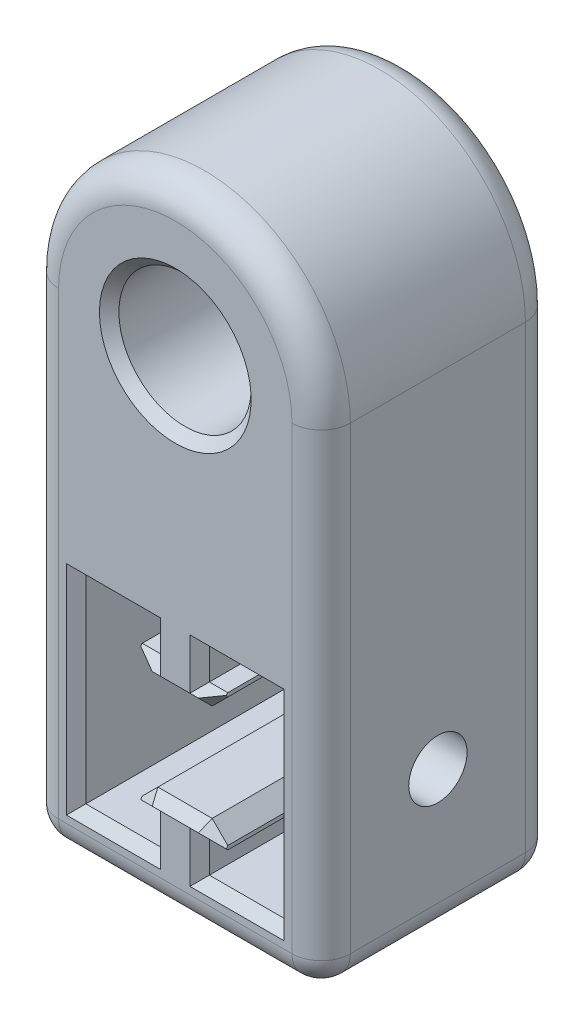
from build123d import *

# Parameters (mm, degrees)
BOSS_EXTRUDE1_DEPTH = 24
SKETCH4_R           = 6.8
BOSS_EXTRUDE2_DEPTH = 24
SKETCH3_R           = 3
CUT_EXTRUDE1_DEPTH  = 64.293680569
FILLET1_R           = 3
SKETCH5_R           = 6.8
SKETCH5_R_2         = 5.5
BOSS_EXTRUDE3_DEPTH = 5
CHAMFER1_SIZE       = 1


with BuildPart() as part:
    # Sketch1 → Boss-Extrude1 (new body)
    with BuildSketch(Plane.XY):
        Polygon((0, 15), (15, 15), (15, -14.949649214), (-15, -14.949649214), (-15, 15), align=None)
        Polygon((-10.2, 10.2), (-2.5, 10.2), (-2.5, 7), (-4.4, 7), (-4.4, 6.61), (-2.79, 5), (2.79, 5), (4.4, 6.61), (4.4, 7), (2.5, 7), (2.5, 10.2), (10.2, 10.2), (10.2, 3.1), (10.2, -3.1), (10.2, -10.2), (2.5, -10.2), (2.5, -7), (4.4, -7), (4.4, -6.61), (2.79, -5), (-2.79, -5), (-4.4, -6.61), (-4.4, -7), (-2.5, -7), (-2.5, -10.2), (-10.2, -10.2), (-10.2, -3.1), (-10.2, 3.1), align=None, mode=Mode.SUBTRACT)
    extrude(amount=BOSS_EXTRUDE1_DEPTH)

    # Sketch4 → Boss-Extrude2 (add)
    with BuildSketch(Plane(origin=(0, 0, 0), x_dir=(-1, 0, 0), z_dir=(0, 0, -1))):
        with BuildLine():
            ThreePointArc((-15, 35.3), (0, 50.3), (15, 35.3))
            Line((15, 35.3), (15, 15))
            Line((15, 15), (-15, 15))
            Line((-15, 15), (-15, 35.3))
        make_face()
        with Locations((0, 35.3)):
            Circle(SKETCH4_R, mode=Mode.SUBTRACT)
    extrude(amount=-BOSS_EXTRUDE2_DEPTH)

    # Sketch3 → Cut-Extrude1 (cut, through all)
    with BuildSketch(Plane.ZY.offset(15)):
        with Locations((12, 0)):
            Circle(SKETCH3_R)
    extrude(amount=-CUT_EXTRUDE1_DEPTH, mode=Mode.SUBTRACT)

    # Fillet1
    fillet1_edges = [part.edges().sort_by_distance(p)[0] for p in [
        (0, -14.949649214, 24),
        (15, 10.175175393, 24),
        (15, 10.175175393, 0),
        (0, -14.949649214, 0),
        (-15, 10.175175393, 0),
        (-15, 10.175175393, 24),
        (15, -14.949649214, 12),
        (-15, -14.949649214, 12),
        (0, 50.3, 24),
        (0, 50.3, 0),
    ]]
    fillet(fillet1_edges, radius=FILLET1_R)

    # Sketch5 → Boss-Extrude3 (add)
    with BuildSketch(Plane(origin=(0, 0, 0), x_dir=(-1, 0, 0), z_dir=(0, 0, -1))):
        with Locations((0, 35.3)):
            Circle(SKETCH5_R)
        with Locations((0, 35.3)):
            Circle(SKETCH5_R_2, mode=Mode.SUBTRACT)
    extrude(amount=-BOSS_EXTRUDE3_DEPTH)

    # Chamfer1
    # the kernel refuses this chamfer: 1 mm, written as the material it takes off along each edge
    with BuildSketch(Plane(origin=(-6.21845448, 8.42845448, 0), x_dir=(-0.019442520806014184, -0.01944252080601427, 0.9996219169112968), z_dir=(0.7071067811865491, -0.707106781186546, 0)), Plane(origin=(0.97154552, 3.18154552, 0), x_dir=(0.01944252080601413, -0.019442520806014215, 0.9996219169112968), z_dir=(0.7071067811865491, 0.707106781186546, 0)), Plane(origin=(6.21845448, -8.42845448, 0), x_dir=(0.01944252080601417, 0.019442520806014284, 0.9996219169112968), z_dir=(-0.7071067811865497, 0.7071067811865456, 0)), Plane(origin=(-0.97154552, -3.18154552, 0), x_dir=(-0.019442520806014007, 0.01944252080601412, 0.9996219169112968), z_dir=(-0.7071067811865497, -0.7071067811865456, 0)), Plane(origin=(-0.97154552, -3.18154552, 24), x_dir=(0.7068394360706715, -0.7068394360706756, 0.027495876610585623), z_dir=(-0.7071067811865497, -0.7071067811865456, 0)), Plane(origin=(6.21845448, -8.42845448, 24), x_dir=(-0.7068394360706715, -0.7068394360706756, 0.027495876610585647), z_dir=(-0.7071067811865497, 0.7071067811865456, 0)), Plane(origin=(0.97154552, 3.18154552, 24), x_dir=(-0.7068394360706718, 0.7068394360706751, 0.027495876610585623), z_dir=(0.7071067811865491, 0.707106781186546, 0)), Plane(origin=(-6.21845448, 8.42845448, 24), x_dir=(0.706839436070672, 0.706839436070675, 0.02749587661058563), z_dir=(0.7071067811865491, -0.707106781186546, 0))) as chamfer1_piece_1:
        Polygon((CHAMFER1_SIZE * 0.999621916911, -CHAMFER1_SIZE * 0.0274958766106), (-CHAMFER1_SIZE * 0.0274958766106, -CHAMFER1_SIZE * 0.999621916911), (0, 0), align=None)
    extrude(amount=7.420249811, mode=Mode.SUBTRACT)
    with BuildSketch(Plane(origin=(-5.361682988, 5, 0), x_dir=(0, -0.027495876610586494, 0.9996219169112968), z_dir=(1, 0, 0)), Plane(origin=(5.361682988, -5, 0), x_dir=(0, 0.027495876610586494, 0.9996219169112968), z_dir=(-1, 0, 0)), Plane(origin=(5.361682988, -5, 24), x_dir=(0, -0.9996219169112968, 0.027495876610585623), z_dir=(-1, 0, 0)), Plane(origin=(-5.361682988, 5, 24), x_dir=(0, 0.9996219169112968, 0.027495876610585623), z_dir=(1, 0, 0))) as chamfer1_piece_2:
        Polygon((CHAMFER1_SIZE * 0.999621916911, -CHAMFER1_SIZE * 0.0274958766106), (-CHAMFER1_SIZE * 0.0274958766106, -CHAMFER1_SIZE * 0.999621916911), (0, 0), align=None)
    extrude(amount=10.723365976, mode=Mode.SUBTRACT)
    with BuildSketch(Plane(origin=(6.971682988, 7, 0), x_dir=(0, 0.027495876610586494, 0.9996219169112968), z_dir=(-1, 0, 0)), Plane(origin=(2.5, -7, 0), x_dir=(0, -0.027495876610586494, 0.9996219169112968), z_dir=(1, 0, 0)), Plane(origin=(-6.971682988, -7, 0), x_dir=(0, -0.027495876610586494, 0.9996219169112968), z_dir=(1, 0, 0)), Plane(origin=(-2.5, 7, 0), x_dir=(0, 0.027495876610586494, 0.9996219169112968), z_dir=(-1, 0, 0)), Plane(origin=(-6.971682988, -7, 24), x_dir=(1.4018567596735031e-15, 0.9996219169112968, 0.027495876610585623), z_dir=(1, 0, 0)), Plane(origin=(2.5, -7, 24), x_dir=(-1.4018567596735031e-15, 0.9996219169112968, 0.027495876610585623), z_dir=(1, 0, 0)), Plane(origin=(6.971682988, 7, 24), x_dir=(0, -0.9996219169112968, 0.027495876610585623), z_dir=(-1, 0, 0)), Plane(origin=(-2.5, 7, 24), x_dir=(0, -0.9996219169112968, 0.027495876610585623), z_dir=(-1, 0, 0))) as chamfer1_piece_3:
        Polygon((CHAMFER1_SIZE * 0.999621916911, -CHAMFER1_SIZE * 0.0274958766106), (-CHAMFER1_SIZE * 0.0274958766106, -CHAMFER1_SIZE * 0.999621916911), (0, 0), align=None)
    extrude(amount=4.471682988, mode=Mode.SUBTRACT)
    with BuildSketch(Plane(origin=(2.5, 7, 0), x_dir=(0.027495876610586494, 0, 0.9996219169112968), z_dir=(0, 1, 0)), Plane(origin=(2.5, -10.2, 0), x_dir=(0.027495876610586494, 0, 0.9996219169112968), z_dir=(0, 1, 0)), Plane(origin=(-2.5, -7, 0), x_dir=(-0.027495876610586494, 0, 0.9996219169112968), z_dir=(0, -1, 0)), Plane(origin=(-2.5, 10.2, 0), x_dir=(-0.027495876610586494, 0, 0.9996219169112968), z_dir=(0, -1, 0)), Plane(origin=(-2.5, 10.2, 24), x_dir=(0.9996219169112968, 3.56524299869048e-14, 0.02749587661058563), z_dir=(0, -1, 0)), Plane(origin=(-2.5, -7, 24), x_dir=(0.9996219169112968, -2.6357827616777824e-15, 0.02749587661058563), z_dir=(0, -1, 0)), Plane(origin=(2.5, -10.2, 24), x_dir=(-0.9996219169112968, -2.6357827616777824e-15, 0.02749587661058563), z_dir=(0, 1, 0)), Plane(origin=(2.5, 7, 24), x_dir=(-0.9996219169112968, 2.3583319446590688e-15, 0.02749587661058563), z_dir=(0, 1, 0))) as chamfer1_piece_4:
        Polygon((CHAMFER1_SIZE * 0.999621916911, -CHAMFER1_SIZE * 0.0274958766106), (-CHAMFER1_SIZE * 0.0274958766106, -CHAMFER1_SIZE * 0.999621916911), (0, 0), align=None)
    extrude(amount=3.2, mode=Mode.SUBTRACT)
    with BuildSketch(Plane(origin=(2.5, 10.2, 0), x_dir=(0, -0.02749587661058563, 0.9996219169112968), z_dir=(1, 0, 0)), Plane(origin=(10.2, -10.2, 0), x_dir=(0, 0.02749587661058563, 0.9996219169112968), z_dir=(-1, 0, 0)), Plane(origin=(-2.5, -10.2, 0), x_dir=(0, 0.02749587661058563, 0.9996219169112968), z_dir=(-1, 0, 0)), Plane(origin=(-10.2, 10.2, 0), x_dir=(0, -0.02749587661058563, 0.9996219169112968), z_dir=(1, 0, 0)), Plane(origin=(-10.2, 10.2, 24), x_dir=(0, 0.9996219169112968, 0.027495876610585647), z_dir=(1, 0, 0)), Plane(origin=(-2.5, -10.2, 24), x_dir=(0, -0.9996219169112968, 0.027495876610585647), z_dir=(-1, 0, 0)), Plane(origin=(10.2, -10.2, 24), x_dir=(0, -0.9996219169112968, 0.027495876610585647), z_dir=(-1, 0, 0)), Plane(origin=(2.5, 10.2, 24), x_dir=(0, 0.9996219169112968, 0.027495876610585647), z_dir=(1, 0, 0))) as chamfer1_piece_5:
        Polygon((CHAMFER1_SIZE * 0.999621916911, -CHAMFER1_SIZE * 0.0274958766106), (-CHAMFER1_SIZE * 0.0274958766106, -CHAMFER1_SIZE * 0.999621916911), (0, 0), align=None)
    extrude(amount=7.7, mode=Mode.SUBTRACT)
    with BuildSketch(Plane(origin=(10.2, 10.2, 0), x_dir=(-0.02749587661058908, 0, 0.9996219169112968), z_dir=(0, -1, 0)), Plane(origin=(-10.2, -10.2, 0), x_dir=(0.027495876610587354, 0, 0.9996219169112968), z_dir=(0, 1, 0))) as chamfer1_piece_6:
        Polygon((CHAMFER1_SIZE * 0.999621916911, -CHAMFER1_SIZE * 0.0274958766106), (-CHAMFER1_SIZE * 0.0274958766106, -CHAMFER1_SIZE * 0.999621916911), (0, 0), align=None)
    extrude(amount=20.4, mode=Mode.SUBTRACT)
    with BuildSketch(Plane(origin=(-10.2, 10.2, 24), x_dir=(-0.9996219169112968, 0, 0.027495876610585647), z_dir=(0, -1, 0)), Plane(origin=(10.2, -10.2, 24), x_dir=(0.9996219169112968, 0, 0.027495876610585647), z_dir=(0, 1, 0))) as chamfer1_piece_7:
        Polygon((CHAMFER1_SIZE * 0.999621916911, CHAMFER1_SIZE * 0.0274958766106), (-CHAMFER1_SIZE * 0.0274958766106, CHAMFER1_SIZE * 0.999621916911), (0, 0), align=None)
    extrude(amount=20.4, mode=Mode.SUBTRACT)
    with BuildSketch(Plane(origin=(0, 35.3, 24), x_dir=(-1, 0, 0), z_dir=(0, -1, 0))) as chamfer1_piece_8:
        Polygon((6.8 + CHAMFER1_SIZE, 0), (6.8, CHAMFER1_SIZE), (6.8, 0), align=None)
    revolve(axis=Axis((0, 35.3, 24), (0, 0, -1)), mode=Mode.SUBTRACT)
    with BuildSketch(Plane(origin=(0, 35.3, 0), x_dir=(-1, 0, 0), z_dir=(0, -1, 0))) as chamfer1_piece_9:
        Polygon((5.5 + CHAMFER1_SIZE, 0), (5.5, -CHAMFER1_SIZE), (5.5, 0), align=None)
    revolve(axis=Axis((0, 35.3, 0), (0, 0, -1)), mode=Mode.SUBTRACT)
    with BuildSketch(Plane(origin=(2.5, 4.428317012, 0), x_dir=(0.027495876610586494, 0, 0.9996219169112968), z_dir=(0, 1, 0))) as chamfer1_piece_10a_section:
        Polygon((CHAMFER1_SIZE * 0.999621916911, -CHAMFER1_SIZE * 0.0274958766106), (-CHAMFER1_SIZE * 0.0274958766106, -CHAMFER1_SIZE * 0.999621916911), (0, 0), align=None)
    chamfer1_piece_10a = extrude(amount=5.771682988, mode=Mode.PRIVATE)
    chamfer1_piece_10a = split(chamfer1_piece_10a, bisect_by=Plane(origin=(2.170206373, 7, 0.329793627), z_dir=(0, -1, 0)), keep=Keep.TOP, mode=Mode.PRIVATE)
    with BuildSketch(Plane(origin=(6.971682988, 7, 0), x_dir=(0, 0.027495876610586494, 0.9996219169112968), z_dir=(-1, 0, 0))) as chamfer1_piece_10b_section:
        Polygon((CHAMFER1_SIZE * 0.999621916911, -CHAMFER1_SIZE * 0.0274958766106), (-CHAMFER1_SIZE * 0.0274958766106, -CHAMFER1_SIZE * 0.999621916911), (0, 0), align=None)
    chamfer1_piece_10b = extrude(amount=7.043365976, mode=Mode.PRIVATE)
    chamfer1_piece_10b = split(chamfer1_piece_10b, bisect_by=Plane(origin=(2.5, 6.670206373, 0.329793627), z_dir=(-1, 0, 0)), keep=Keep.TOP, mode=Mode.PRIVATE)
    chamfer1_piece_10 = chamfer1_piece_10a & chamfer1_piece_10b
    add(chamfer1_piece_10, mode=Mode.SUBTRACT)
    with BuildSketch(Plane(origin=(-0.071682988, 10.2, 0), x_dir=(0, -0.02749587661058563, 0.9996219169112968), z_dir=(1, 0, 0))) as chamfer1_piece_11a_section:
        Polygon((CHAMFER1_SIZE * 0.999621916911, -CHAMFER1_SIZE * 0.0274958766106), (-CHAMFER1_SIZE * 0.0274958766106, -CHAMFER1_SIZE * 0.999621916911), (0, 0), align=None)
    chamfer1_piece_11a = extrude(amount=10.271682988, mode=Mode.PRIVATE)
    chamfer1_piece_11a = split(chamfer1_piece_11a, bisect_by=Plane(origin=(2.5, 10.529793627, 0.329793627), z_dir=(-1, 0, 0)), keep=Keep.TOP, mode=Mode.PRIVATE)
    with BuildSketch(Plane(origin=(2.5, 7, 0), x_dir=(0.027495876610586494, 0, 0.9996219169112968), z_dir=(0, 1, 0))) as chamfer1_piece_11b_section:
        Polygon((CHAMFER1_SIZE * 0.999621916911, -CHAMFER1_SIZE * 0.0274958766106), (-CHAMFER1_SIZE * 0.0274958766106, -CHAMFER1_SIZE * 0.999621916911), (0, 0), align=None)
    chamfer1_piece_11b = extrude(amount=5.771682988, mode=Mode.PRIVATE)
    chamfer1_piece_11b = split(chamfer1_piece_11b, bisect_by=Plane(origin=(2.170206373, 10.2, 0.329793627), z_dir=(0, 1, 0)), keep=Keep.TOP, mode=Mode.PRIVATE)
    chamfer1_piece_11 = chamfer1_piece_11a & chamfer1_piece_11b
    add(chamfer1_piece_11, mode=Mode.SUBTRACT)
    with BuildSketch(Plane(origin=(10.2, 12.771682988, 0), x_dir=(-0.02749587661058563, 0, 0.9996219169112968), z_dir=(0, -1, 0))) as chamfer1_piece_12a_section:
        Polygon((CHAMFER1_SIZE * 0.999621916911, -CHAMFER1_SIZE * 0.0274958766106), (-CHAMFER1_SIZE * 0.0274958766106, -CHAMFER1_SIZE * 0.999621916911), (0, 0), align=None)
    chamfer1_piece_12a = extrude(amount=22.971682988, mode=Mode.PRIVATE)
    chamfer1_piece_12a = split(chamfer1_piece_12a, bisect_by=Plane(origin=(10.529793627, 10.2, 0.329793627), z_dir=(0, 1, 0)), keep=Keep.TOP, mode=Mode.PRIVATE)
    with BuildSketch(Plane(origin=(2.5, 10.2, 0), x_dir=(0, -0.02749587661058563, 0.9996219169112968), z_dir=(1, 0, 0))) as chamfer1_piece_12b_section:
        Polygon((CHAMFER1_SIZE * 0.999621916911, -CHAMFER1_SIZE * 0.0274958766106), (-CHAMFER1_SIZE * 0.0274958766106, -CHAMFER1_SIZE * 0.999621916911), (0, 0), align=None)
    chamfer1_piece_12b = extrude(amount=10.271682988, mode=Mode.PRIVATE)
    chamfer1_piece_12b = split(chamfer1_piece_12b, bisect_by=Plane(origin=(10.2, 10.529793627, 0.329793627), z_dir=(1, 0, 0)), keep=Keep.TOP, mode=Mode.PRIVATE)
    chamfer1_piece_12 = chamfer1_piece_12a & chamfer1_piece_12b
    add(chamfer1_piece_12, mode=Mode.SUBTRACT)
    with BuildSketch(Plane(origin=(12.771682988, -10.2, 0), x_dir=(0, 0.02749587661058563, 0.9996219169112968), z_dir=(-1, 0, 0))) as chamfer1_piece_13a_section:
        Polygon((CHAMFER1_SIZE * 0.999621916911, -CHAMFER1_SIZE * 0.0274958766106), (-CHAMFER1_SIZE * 0.0274958766106, -CHAMFER1_SIZE * 0.999621916911), (0, 0), align=None)
    chamfer1_piece_13a = extrude(amount=10.271682988, mode=Mode.PRIVATE)
    chamfer1_piece_13a = split(chamfer1_piece_13a, bisect_by=Plane(origin=(10.2, -10.529793627, 0.329793627), z_dir=(1, 0, 0)), keep=Keep.TOP, mode=Mode.PRIVATE)
    with BuildSketch(Plane(origin=(10.2, 10.2, 0), x_dir=(-0.02749587661058908, 0, 0.9996219169112968), z_dir=(0, -1, 0))) as chamfer1_piece_13b_section:
        Polygon((CHAMFER1_SIZE * 0.999621916911, -CHAMFER1_SIZE * 0.0274958766106), (-CHAMFER1_SIZE * 0.0274958766106, -CHAMFER1_SIZE * 0.999621916911), (0, 0), align=None)
    chamfer1_piece_13b = extrude(amount=22.971682988, mode=Mode.PRIVATE)
    chamfer1_piece_13b = split(chamfer1_piece_13b, bisect_by=Plane(origin=(10.529793627, -10.2, 0.329793627), z_dir=(0, -1, 0)), keep=Keep.TOP, mode=Mode.PRIVATE)
    chamfer1_piece_13 = chamfer1_piece_13a & chamfer1_piece_13b
    add(chamfer1_piece_13, mode=Mode.SUBTRACT)
    with BuildSketch(Plane(origin=(2.5, -12.771682988, 0), x_dir=(0.027495876610586494, 0, 0.9996219169112968), z_dir=(0, 1, 0))) as chamfer1_piece_14a_section:
        Polygon((CHAMFER1_SIZE * 0.999621916911, -CHAMFER1_SIZE * 0.0274958766106), (-CHAMFER1_SIZE * 0.0274958766106, -CHAMFER1_SIZE * 0.999621916911), (0, 0), align=None)
    chamfer1_piece_14a = extrude(amount=5.771682988, mode=Mode.PRIVATE)
    chamfer1_piece_14a = split(chamfer1_piece_14a, bisect_by=Plane(origin=(2.170206373, -10.2, 0.329793627), z_dir=(0, -1, 0)), keep=Keep.TOP, mode=Mode.PRIVATE)
    with BuildSketch(Plane(origin=(10.2, -10.2, 0), x_dir=(0, 0.02749587661058563, 0.9996219169112968), z_dir=(-1, 0, 0))) as chamfer1_piece_14b_section:
        Polygon((CHAMFER1_SIZE * 0.999621916911, -CHAMFER1_SIZE * 0.0274958766106), (-CHAMFER1_SIZE * 0.0274958766106, -CHAMFER1_SIZE * 0.999621916911), (0, 0), align=None)
    chamfer1_piece_14b = extrude(amount=10.271682988, mode=Mode.PRIVATE)
    chamfer1_piece_14b = split(chamfer1_piece_14b, bisect_by=Plane(origin=(2.5, -10.529793627, 0.329793627), z_dir=(-1, 0, 0)), keep=Keep.TOP, mode=Mode.PRIVATE)
    chamfer1_piece_14 = chamfer1_piece_14a & chamfer1_piece_14b
    add(chamfer1_piece_14, mode=Mode.SUBTRACT)
    with BuildSketch(Plane(origin=(-0.071682988, -7, 0), x_dir=(0, -0.027495876610586494, 0.9996219169112968), z_dir=(1, 0, 0))) as chamfer1_piece_15a_section:
        Polygon((CHAMFER1_SIZE * 0.999621916911, -CHAMFER1_SIZE * 0.0274958766106), (-CHAMFER1_SIZE * 0.0274958766106, -CHAMFER1_SIZE * 0.999621916911), (0, 0), align=None)
    chamfer1_piece_15a = extrude(amount=7.043365976, mode=Mode.PRIVATE)
    chamfer1_piece_15a = split(chamfer1_piece_15a, bisect_by=Plane(origin=(2.5, -6.670206373, 0.329793627), z_dir=(-1, 0, 0)), keep=Keep.TOP, mode=Mode.PRIVATE)
    with BuildSketch(Plane(origin=(2.5, -10.2, 0), x_dir=(0.027495876610586494, 0, 0.9996219169112968), z_dir=(0, 1, 0))) as chamfer1_piece_15b_section:
        Polygon((CHAMFER1_SIZE * 0.999621916911, -CHAMFER1_SIZE * 0.0274958766106), (-CHAMFER1_SIZE * 0.0274958766106, -CHAMFER1_SIZE * 0.999621916911), (0, 0), align=None)
    chamfer1_piece_15b = extrude(amount=5.771682988, mode=Mode.PRIVATE)
    chamfer1_piece_15b = split(chamfer1_piece_15b, bisect_by=Plane(origin=(2.170206373, -7, 0.329793627), z_dir=(0, 1, 0)), keep=Keep.TOP, mode=Mode.PRIVATE)
    chamfer1_piece_15 = chamfer1_piece_15a & chamfer1_piece_15b
    add(chamfer1_piece_15, mode=Mode.SUBTRACT)
    with BuildSketch(Plane(origin=(-2.5, -4.428317012, 0), x_dir=(-0.027495876610586494, 0, 0.9996219169112968), z_dir=(0, -1, 0))) as chamfer1_piece_16a_section:
        Polygon((CHAMFER1_SIZE * 0.999621916911, -CHAMFER1_SIZE * 0.0274958766106), (-CHAMFER1_SIZE * 0.0274958766106, -CHAMFER1_SIZE * 0.999621916911), (0, 0), align=None)
    chamfer1_piece_16a = extrude(amount=5.771682988, mode=Mode.PRIVATE)
    chamfer1_piece_16a = split(chamfer1_piece_16a, bisect_by=Plane(origin=(-2.170206373, -7, 0.329793627), z_dir=(0, 1, 0)), keep=Keep.TOP, mode=Mode.PRIVATE)
    with BuildSketch(Plane(origin=(-6.971682988, -7, 0), x_dir=(0, -0.027495876610586494, 0.9996219169112968), z_dir=(1, 0, 0))) as chamfer1_piece_16b_section:
        Polygon((CHAMFER1_SIZE * 0.999621916911, -CHAMFER1_SIZE * 0.0274958766106), (-CHAMFER1_SIZE * 0.0274958766106, -CHAMFER1_SIZE * 0.999621916911), (0, 0), align=None)
    chamfer1_piece_16b = extrude(amount=7.043365976, mode=Mode.PRIVATE)
    chamfer1_piece_16b = split(chamfer1_piece_16b, bisect_by=Plane(origin=(-2.5, -6.670206373, 0.329793627), z_dir=(1, 0, 0)), keep=Keep.TOP, mode=Mode.PRIVATE)
    chamfer1_piece_16 = chamfer1_piece_16a & chamfer1_piece_16b
    add(chamfer1_piece_16, mode=Mode.SUBTRACT)
    with BuildSketch(Plane(origin=(0.071682988, -10.2, 0), x_dir=(0, 0.02749587661058563, 0.9996219169112968), z_dir=(-1, 0, 0))) as chamfer1_piece_17a_section:
        Polygon((CHAMFER1_SIZE * 0.999621916911, -CHAMFER1_SIZE * 0.0274958766106), (-CHAMFER1_SIZE * 0.0274958766106, -CHAMFER1_SIZE * 0.999621916911), (0, 0), align=None)
    chamfer1_piece_17a = extrude(amount=10.271682988, mode=Mode.PRIVATE)
    chamfer1_piece_17a = split(chamfer1_piece_17a, bisect_by=Plane(origin=(-2.5, -10.529793627, 0.329793627), z_dir=(1, 0, 0)), keep=Keep.TOP, mode=Mode.PRIVATE)
    with BuildSketch(Plane(origin=(-2.5, -7, 0), x_dir=(-0.027495876610586494, 0, 0.9996219169112968), z_dir=(0, -1, 0))) as chamfer1_piece_17b_section:
        Polygon((CHAMFER1_SIZE * 0.999621916911, -CHAMFER1_SIZE * 0.0274958766106), (-CHAMFER1_SIZE * 0.0274958766106, -CHAMFER1_SIZE * 0.999621916911), (0, 0), align=None)
    chamfer1_piece_17b = extrude(amount=5.771682988, mode=Mode.PRIVATE)
    chamfer1_piece_17b = split(chamfer1_piece_17b, bisect_by=Plane(origin=(-2.170206373, -10.2, 0.329793627), z_dir=(0, -1, 0)), keep=Keep.TOP, mode=Mode.PRIVATE)
    chamfer1_piece_17 = chamfer1_piece_17a & chamfer1_piece_17b
    add(chamfer1_piece_17, mode=Mode.SUBTRACT)
    with BuildSketch(Plane(origin=(-10.2, -12.771682988, 0), x_dir=(0.02749587661058563, 0, 0.9996219169112968), z_dir=(0, 1, 0))) as chamfer1_piece_18a_section:
        Polygon((CHAMFER1_SIZE * 0.999621916911, -CHAMFER1_SIZE * 0.0274958766106), (-CHAMFER1_SIZE * 0.0274958766106, -CHAMFER1_SIZE * 0.999621916911), (0, 0), align=None)
    chamfer1_piece_18a = extrude(amount=22.971682988, mode=Mode.PRIVATE)
    chamfer1_piece_18a = split(chamfer1_piece_18a, bisect_by=Plane(origin=(-10.529793627, -10.2, 0.329793627), z_dir=(0, -1, 0)), keep=Keep.TOP, mode=Mode.PRIVATE)
    with BuildSketch(Plane(origin=(-2.5, -10.2, 0), x_dir=(0, 0.02749587661058563, 0.9996219169112968), z_dir=(-1, 0, 0))) as chamfer1_piece_18b_section:
        Polygon((CHAMFER1_SIZE * 0.999621916911, -CHAMFER1_SIZE * 0.0274958766106), (-CHAMFER1_SIZE * 0.0274958766106, -CHAMFER1_SIZE * 0.999621916911), (0, 0), align=None)
    chamfer1_piece_18b = extrude(amount=10.271682988, mode=Mode.PRIVATE)
    chamfer1_piece_18b = split(chamfer1_piece_18b, bisect_by=Plane(origin=(-10.2, -10.529793627, 0.329793627), z_dir=(-1, 0, 0)), keep=Keep.TOP, mode=Mode.PRIVATE)
    chamfer1_piece_18 = chamfer1_piece_18a & chamfer1_piece_18b
    add(chamfer1_piece_18, mode=Mode.SUBTRACT)
    with BuildSketch(Plane(origin=(-10.2, -10.2, 0), x_dir=(0.027495876610587354, 0, 0.9996219169112968), z_dir=(0, 1, 0))) as chamfer1_piece_19a_section:
        Polygon((CHAMFER1_SIZE * 0.999621916911, -CHAMFER1_SIZE * 0.0274958766106), (-CHAMFER1_SIZE * 0.0274958766106, -CHAMFER1_SIZE * 0.999621916911), (0, 0), align=None)
    chamfer1_piece_19a = extrude(amount=22.971682988, mode=Mode.PRIVATE)
    chamfer1_piece_19a = split(chamfer1_piece_19a, bisect_by=Plane(origin=(-10.529793627, 10.2, 0.329793627), z_dir=(0, 1, 0)), keep=Keep.TOP, mode=Mode.PRIVATE)
    with BuildSketch(Plane(origin=(-12.771682988, 10.2, 0), x_dir=(0, -0.02749587661058563, 0.9996219169112968), z_dir=(1, 0, 0))) as chamfer1_piece_19b_section:
        Polygon((CHAMFER1_SIZE * 0.999621916911, -CHAMFER1_SIZE * 0.0274958766106), (-CHAMFER1_SIZE * 0.0274958766106, -CHAMFER1_SIZE * 0.999621916911), (0, 0), align=None)
    chamfer1_piece_19b = extrude(amount=10.271682988, mode=Mode.PRIVATE)
    chamfer1_piece_19b = split(chamfer1_piece_19b, bisect_by=Plane(origin=(-10.2, 10.529793627, 0.329793627), z_dir=(-1, 0, 0)), keep=Keep.TOP, mode=Mode.PRIVATE)
    chamfer1_piece_19 = chamfer1_piece_19a & chamfer1_piece_19b
    add(chamfer1_piece_19, mode=Mode.SUBTRACT)
    with BuildSketch(Plane(origin=(-2.5, 12.771682988, 0), x_dir=(-0.027495876610586494, 0, 0.9996219169112968), z_dir=(0, -1, 0))) as chamfer1_piece_20a_section:
        Polygon((CHAMFER1_SIZE * 0.999621916911, -CHAMFER1_SIZE * 0.0274958766106), (-CHAMFER1_SIZE * 0.0274958766106, -CHAMFER1_SIZE * 0.999621916911), (0, 0), align=None)
    chamfer1_piece_20a = extrude(amount=5.771682988, mode=Mode.PRIVATE)
    chamfer1_piece_20a = split(chamfer1_piece_20a, bisect_by=Plane(origin=(-2.170206373, 10.2, 0.329793627), z_dir=(0, 1, 0)), keep=Keep.TOP, mode=Mode.PRIVATE)
    with BuildSketch(Plane(origin=(-10.2, 10.2, 0), x_dir=(0, -0.02749587661058563, 0.9996219169112968), z_dir=(1, 0, 0))) as chamfer1_piece_20b_section:
        Polygon((CHAMFER1_SIZE * 0.999621916911, -CHAMFER1_SIZE * 0.0274958766106), (-CHAMFER1_SIZE * 0.0274958766106, -CHAMFER1_SIZE * 0.999621916911), (0, 0), align=None)
    chamfer1_piece_20b = extrude(amount=10.271682988, mode=Mode.PRIVATE)
    chamfer1_piece_20b = split(chamfer1_piece_20b, bisect_by=Plane(origin=(-2.5, 10.529793627, 0.329793627), z_dir=(1, 0, 0)), keep=Keep.TOP, mode=Mode.PRIVATE)
    chamfer1_piece_20 = chamfer1_piece_20a & chamfer1_piece_20b
    add(chamfer1_piece_20, mode=Mode.SUBTRACT)
    with BuildSketch(Plane(origin=(0.071682988, 7, 0), x_dir=(0, 0.027495876610586494, 0.9996219169112968), z_dir=(-1, 0, 0))) as chamfer1_piece_21a_section:
        Polygon((CHAMFER1_SIZE * 0.999621916911, -CHAMFER1_SIZE * 0.0274958766106), (-CHAMFER1_SIZE * 0.0274958766106, -CHAMFER1_SIZE * 0.999621916911), (0, 0), align=None)
    chamfer1_piece_21a = extrude(amount=7.043365976, mode=Mode.PRIVATE)
    chamfer1_piece_21a = split(chamfer1_piece_21a, bisect_by=Plane(origin=(-2.5, 6.670206373, 0.329793627), z_dir=(1, 0, 0)), keep=Keep.TOP, mode=Mode.PRIVATE)
    with BuildSketch(Plane(origin=(-2.5, 10.2, 0), x_dir=(-0.027495876610586494, 0, 0.9996219169112968), z_dir=(0, -1, 0))) as chamfer1_piece_21b_section:
        Polygon((CHAMFER1_SIZE * 0.999621916911, -CHAMFER1_SIZE * 0.0274958766106), (-CHAMFER1_SIZE * 0.0274958766106, -CHAMFER1_SIZE * 0.999621916911), (0, 0), align=None)
    chamfer1_piece_21b = extrude(amount=5.771682988, mode=Mode.PRIVATE)
    chamfer1_piece_21b = split(chamfer1_piece_21b, bisect_by=Plane(origin=(-2.170206373, 7, 0.329793627), z_dir=(0, -1, 0)), keep=Keep.TOP, mode=Mode.PRIVATE)
    chamfer1_piece_21 = chamfer1_piece_21a & chamfer1_piece_21b
    add(chamfer1_piece_21, mode=Mode.SUBTRACT)
    with BuildSketch(Plane(origin=(-2.5, 12.771682988, 24), x_dir=(0.9996219169112968, 3.56524299869048e-14, 0.02749587661058563), z_dir=(0, -1, 0))) as chamfer1_piece_22a_section:
        Polygon((CHAMFER1_SIZE * 0.999621916911, -CHAMFER1_SIZE * 0.0274958766106), (-CHAMFER1_SIZE * 0.0274958766106, -CHAMFER1_SIZE * 0.999621916911), (0, 0), align=None)
    chamfer1_piece_22a = extrude(amount=5.771682988, mode=Mode.PRIVATE)
    chamfer1_piece_22a = split(chamfer1_piece_22a, bisect_by=Plane(origin=(-2.170206373, 10.2, 23.670206373), z_dir=(0, 1, 0)), keep=Keep.TOP, mode=Mode.PRIVATE)
    with BuildSketch(Plane(origin=(-10.2, 10.2, 24), x_dir=(0, 0.9996219169112968, 0.027495876610585647), z_dir=(1, 0, 0))) as chamfer1_piece_22b_section:
        Polygon((CHAMFER1_SIZE * 0.999621916911, -CHAMFER1_SIZE * 0.0274958766106), (-CHAMFER1_SIZE * 0.0274958766106, -CHAMFER1_SIZE * 0.999621916911), (0, 0), align=None)
    chamfer1_piece_22b = extrude(amount=10.271682988, mode=Mode.PRIVATE)
    chamfer1_piece_22b = split(chamfer1_piece_22b, bisect_by=Plane(origin=(-2.5, 10.529793627, 23.670206373), z_dir=(1, 0, 0)), keep=Keep.TOP, mode=Mode.PRIVATE)
    chamfer1_piece_22 = chamfer1_piece_22a & chamfer1_piece_22b
    add(chamfer1_piece_22, mode=Mode.SUBTRACT)
    with BuildSketch(Plane(origin=(0.071682988, 7, 24), x_dir=(0, -0.9996219169112968, 0.027495876610585623), z_dir=(-1, 0, 0))) as chamfer1_piece_23a_section:
        Polygon((CHAMFER1_SIZE * 0.999621916911, -CHAMFER1_SIZE * 0.0274958766106), (-CHAMFER1_SIZE * 0.0274958766106, -CHAMFER1_SIZE * 0.999621916911), (0, 0), align=None)
    chamfer1_piece_23a = extrude(amount=7.043365976, mode=Mode.PRIVATE)
    chamfer1_piece_23a = split(chamfer1_piece_23a, bisect_by=Plane(origin=(-2.5, 6.670206373, 23.670206373), z_dir=(1, 0, 0)), keep=Keep.TOP, mode=Mode.PRIVATE)
    with BuildSketch(Plane(origin=(-2.5, 10.2, 24), x_dir=(0.9996219169112968, 3.56524299869048e-14, 0.02749587661058563), z_dir=(0, -1, 0))) as chamfer1_piece_23b_section:
        Polygon((CHAMFER1_SIZE * 0.999621916911, -CHAMFER1_SIZE * 0.0274958766106), (-CHAMFER1_SIZE * 0.0274958766106, -CHAMFER1_SIZE * 0.999621916911), (0, 0), align=None)
    chamfer1_piece_23b = extrude(amount=5.771682988, mode=Mode.PRIVATE)
    chamfer1_piece_23b = split(chamfer1_piece_23b, bisect_by=Plane(origin=(-2.170206373, 7, 23.670206373), z_dir=(0, -1, 0)), keep=Keep.TOP, mode=Mode.PRIVATE)
    chamfer1_piece_23 = chamfer1_piece_23a & chamfer1_piece_23b
    add(chamfer1_piece_23, mode=Mode.SUBTRACT)
    with BuildSketch(Plane(origin=(-10.2, 12.771682988, 24), x_dir=(-0.9996219169112968, 0, 0.027495876610585647), z_dir=(0, -1, 0))) as chamfer1_piece_24a_section:
        Polygon((CHAMFER1_SIZE * 0.999621916911, CHAMFER1_SIZE * 0.0274958766106), (-CHAMFER1_SIZE * 0.0274958766106, CHAMFER1_SIZE * 0.999621916911), (0, 0), align=None)
    chamfer1_piece_24a = extrude(amount=22.971682988, mode=Mode.PRIVATE)
    chamfer1_piece_24a = split(chamfer1_piece_24a, bisect_by=Plane(origin=(-10.529793627, 10.2, 23.670206373), z_dir=(0, 1, 0)), keep=Keep.TOP, mode=Mode.PRIVATE)
    with BuildSketch(Plane(origin=(-12.771682988, 10.2, 24), x_dir=(0, 0.9996219169112968, 0.027495876610585647), z_dir=(1, 0, 0))) as chamfer1_piece_24b_section:
        Polygon((CHAMFER1_SIZE * 0.999621916911, -CHAMFER1_SIZE * 0.0274958766106), (-CHAMFER1_SIZE * 0.0274958766106, -CHAMFER1_SIZE * 0.999621916911), (0, 0), align=None)
    chamfer1_piece_24b = extrude(amount=10.271682988, mode=Mode.PRIVATE)
    chamfer1_piece_24b = split(chamfer1_piece_24b, bisect_by=Plane(origin=(-10.2, 10.529793627, 23.670206373), z_dir=(-1, 0, 0)), keep=Keep.TOP, mode=Mode.PRIVATE)
    chamfer1_piece_24 = chamfer1_piece_24a & chamfer1_piece_24b
    add(chamfer1_piece_24, mode=Mode.SUBTRACT)
    with BuildSketch(Plane(origin=(-10.2, 10.2, 24), x_dir=(-0.9996219169112968, 0, 0.027495876610585647), z_dir=(0, -1, 0))) as chamfer1_piece_25a_section:
        Polygon((CHAMFER1_SIZE * 0.999621916911, CHAMFER1_SIZE * 0.0274958766106), (-CHAMFER1_SIZE * 0.0274958766106, CHAMFER1_SIZE * 0.999621916911), (0, 0), align=None)
    chamfer1_piece_25a = extrude(amount=22.971682988, mode=Mode.PRIVATE)
    chamfer1_piece_25a = split(chamfer1_piece_25a, bisect_by=Plane(origin=(-10.529793627, -10.2, 23.670206373), z_dir=(0, -1, 0)), keep=Keep.TOP, mode=Mode.PRIVATE)
    with BuildSketch(Plane(origin=(-2.5, -10.2, 24), x_dir=(0, -0.9996219169112968, 0.027495876610585647), z_dir=(-1, 0, 0))) as chamfer1_piece_25b_section:
        Polygon((CHAMFER1_SIZE * 0.999621916911, -CHAMFER1_SIZE * 0.0274958766106), (-CHAMFER1_SIZE * 0.0274958766106, -CHAMFER1_SIZE * 0.999621916911), (0, 0), align=None)
    chamfer1_piece_25b = extrude(amount=10.271682988, mode=Mode.PRIVATE)
    chamfer1_piece_25b = split(chamfer1_piece_25b, bisect_by=Plane(origin=(-10.2, -10.529793627, 23.670206373), z_dir=(-1, 0, 0)), keep=Keep.TOP, mode=Mode.PRIVATE)
    chamfer1_piece_25 = chamfer1_piece_25a & chamfer1_piece_25b
    add(chamfer1_piece_25, mode=Mode.SUBTRACT)
    with BuildSketch(Plane(origin=(0.071682988, -10.2, 24), x_dir=(0, -0.9996219169112968, 0.027495876610585647), z_dir=(-1, 0, 0))) as chamfer1_piece_26a_section:
        Polygon((CHAMFER1_SIZE * 0.999621916911, -CHAMFER1_SIZE * 0.0274958766106), (-CHAMFER1_SIZE * 0.0274958766106, -CHAMFER1_SIZE * 0.999621916911), (0, 0), align=None)
    chamfer1_piece_26a = extrude(amount=10.271682988, mode=Mode.PRIVATE)
    chamfer1_piece_26a = split(chamfer1_piece_26a, bisect_by=Plane(origin=(-2.5, -10.529793627, 23.670206373), z_dir=(1, 0, 0)), keep=Keep.TOP, mode=Mode.PRIVATE)
    with BuildSketch(Plane(origin=(-2.5, -7, 24), x_dir=(0.9996219169112968, -2.6357827616777824e-15, 0.02749587661058563), z_dir=(0, -1, 0))) as chamfer1_piece_26b_section:
        Polygon((CHAMFER1_SIZE * 0.999621916911, -CHAMFER1_SIZE * 0.0274958766106), (-CHAMFER1_SIZE * 0.0274958766106, -CHAMFER1_SIZE * 0.999621916911), (0, 0), align=None)
    chamfer1_piece_26b = extrude(amount=5.771682988, mode=Mode.PRIVATE)
    chamfer1_piece_26b = split(chamfer1_piece_26b, bisect_by=Plane(origin=(-2.170206373, -10.2, 23.670206373), z_dir=(0, -1, 0)), keep=Keep.TOP, mode=Mode.PRIVATE)
    chamfer1_piece_26 = chamfer1_piece_26a & chamfer1_piece_26b
    add(chamfer1_piece_26, mode=Mode.SUBTRACT)
    with BuildSketch(Plane(origin=(-2.5, -4.428317012, 24), x_dir=(0.9996219169112968, -2.6357827616777824e-15, 0.02749587661058563), z_dir=(0, -1, 0))) as chamfer1_piece_27a_section:
        Polygon((CHAMFER1_SIZE * 0.999621916911, -CHAMFER1_SIZE * 0.0274958766106), (-CHAMFER1_SIZE * 0.0274958766106, -CHAMFER1_SIZE * 0.999621916911), (0, 0), align=None)
    chamfer1_piece_27a = extrude(amount=5.771682988, mode=Mode.PRIVATE)
    chamfer1_piece_27a = split(chamfer1_piece_27a, bisect_by=Plane(origin=(-2.170206373, -7, 23.670206373), z_dir=(0, 1, 0)), keep=Keep.TOP, mode=Mode.PRIVATE)
    with BuildSketch(Plane(origin=(-6.971682988, -7, 24), x_dir=(1.4018567596735031e-15, 0.9996219169112968, 0.027495876610585623), z_dir=(1, 0, 0))) as chamfer1_piece_27b_section:
        Polygon((CHAMFER1_SIZE * 0.999621916911, -CHAMFER1_SIZE * 0.0274958766106), (-CHAMFER1_SIZE * 0.0274958766106, -CHAMFER1_SIZE * 0.999621916911), (0, 0), align=None)
    chamfer1_piece_27b = extrude(amount=7.043365976, mode=Mode.PRIVATE)
    chamfer1_piece_27b = split(chamfer1_piece_27b, bisect_by=Plane(origin=(-2.5, -6.670206373, 23.670206373), z_dir=(1, 0, 0)), keep=Keep.TOP, mode=Mode.PRIVATE)
    chamfer1_piece_27 = chamfer1_piece_27a & chamfer1_piece_27b
    add(chamfer1_piece_27, mode=Mode.SUBTRACT)
    with BuildSketch(Plane(origin=(-0.071682988, -7, 24), x_dir=(-1.4018567596735031e-15, 0.9996219169112968, 0.027495876610585623), z_dir=(1, 0, 0))) as chamfer1_piece_28a_section:
        Polygon((CHAMFER1_SIZE * 0.999621916911, -CHAMFER1_SIZE * 0.0274958766106), (-CHAMFER1_SIZE * 0.0274958766106, -CHAMFER1_SIZE * 0.999621916911), (0, 0), align=None)
    chamfer1_piece_28a = extrude(amount=7.043365976, mode=Mode.PRIVATE)
    chamfer1_piece_28a = split(chamfer1_piece_28a, bisect_by=Plane(origin=(2.5, -6.670206373, 23.670206373), z_dir=(-1, 0, 0)), keep=Keep.TOP, mode=Mode.PRIVATE)
    with BuildSketch(Plane(origin=(2.5, -10.2, 24), x_dir=(-0.9996219169112968, -2.6357827616777824e-15, 0.02749587661058563), z_dir=(0, 1, 0))) as chamfer1_piece_28b_section:
        Polygon((CHAMFER1_SIZE * 0.999621916911, -CHAMFER1_SIZE * 0.0274958766106), (-CHAMFER1_SIZE * 0.0274958766106, -CHAMFER1_SIZE * 0.999621916911), (0, 0), align=None)
    chamfer1_piece_28b = extrude(amount=5.771682988, mode=Mode.PRIVATE)
    chamfer1_piece_28b = split(chamfer1_piece_28b, bisect_by=Plane(origin=(2.170206373, -7, 23.670206373), z_dir=(0, 1, 0)), keep=Keep.TOP, mode=Mode.PRIVATE)
    chamfer1_piece_28 = chamfer1_piece_28a & chamfer1_piece_28b
    add(chamfer1_piece_28, mode=Mode.SUBTRACT)
    with BuildSketch(Plane(origin=(2.5, -12.771682988, 24), x_dir=(-0.9996219169112968, -2.6357827616777824e-15, 0.02749587661058563), z_dir=(0, 1, 0))) as chamfer1_piece_29a_section:
        Polygon((CHAMFER1_SIZE * 0.999621916911, -CHAMFER1_SIZE * 0.0274958766106), (-CHAMFER1_SIZE * 0.0274958766106, -CHAMFER1_SIZE * 0.999621916911), (0, 0), align=None)
    chamfer1_piece_29a = extrude(amount=5.771682988, mode=Mode.PRIVATE)
    chamfer1_piece_29a = split(chamfer1_piece_29a, bisect_by=Plane(origin=(2.170206373, -10.2, 23.670206373), z_dir=(0, -1, 0)), keep=Keep.TOP, mode=Mode.PRIVATE)
    with BuildSketch(Plane(origin=(10.2, -10.2, 24), x_dir=(0, -0.9996219169112968, 0.027495876610585647), z_dir=(-1, 0, 0))) as chamfer1_piece_29b_section:
        Polygon((CHAMFER1_SIZE * 0.999621916911, -CHAMFER1_SIZE * 0.0274958766106), (-CHAMFER1_SIZE * 0.0274958766106, -CHAMFER1_SIZE * 0.999621916911), (0, 0), align=None)
    chamfer1_piece_29b = extrude(amount=10.271682988, mode=Mode.PRIVATE)
    chamfer1_piece_29b = split(chamfer1_piece_29b, bisect_by=Plane(origin=(2.5, -10.529793627, 23.670206373), z_dir=(-1, 0, 0)), keep=Keep.TOP, mode=Mode.PRIVATE)
    chamfer1_piece_29 = chamfer1_piece_29a & chamfer1_piece_29b
    add(chamfer1_piece_29, mode=Mode.SUBTRACT)
    with BuildSketch(Plane(origin=(12.771682988, -10.2, 24), x_dir=(0, -0.9996219169112968, 0.027495876610585647), z_dir=(-1, 0, 0))) as chamfer1_piece_30a_section:
        Polygon((CHAMFER1_SIZE * 0.999621916911, -CHAMFER1_SIZE * 0.0274958766106), (-CHAMFER1_SIZE * 0.0274958766106, -CHAMFER1_SIZE * 0.999621916911), (0, 0), align=None)
    chamfer1_piece_30a = extrude(amount=10.271682988, mode=Mode.PRIVATE)
    chamfer1_piece_30a = split(chamfer1_piece_30a, bisect_by=Plane(origin=(10.2, -10.529793627, 23.670206373), z_dir=(1, 0, 0)), keep=Keep.TOP, mode=Mode.PRIVATE)
    with BuildSketch(Plane(origin=(10.2, -12.771682988, 24), x_dir=(0.9996219169112968, 0, 0.027495876610585647), z_dir=(0, 1, 0))) as chamfer1_piece_30b_section:
        Polygon((CHAMFER1_SIZE * 0.999621916911, CHAMFER1_SIZE * 0.0274958766106), (-CHAMFER1_SIZE * 0.0274958766106, CHAMFER1_SIZE * 0.999621916911), (0, 0), align=None)
    chamfer1_piece_30b = extrude(amount=22.971682988, mode=Mode.PRIVATE)
    chamfer1_piece_30b = split(chamfer1_piece_30b, bisect_by=Plane(origin=(10.529793627, -10.2, 23.670206373), z_dir=(0, -1, 0)), keep=Keep.TOP, mode=Mode.PRIVATE)
    chamfer1_piece_30 = chamfer1_piece_30a & chamfer1_piece_30b
    add(chamfer1_piece_30, mode=Mode.SUBTRACT)
    with BuildSketch(Plane(origin=(10.2, -10.2, 24), x_dir=(0.9996219169112968, 0, 0.027495876610585647), z_dir=(0, 1, 0))) as chamfer1_piece_31a_section:
        Polygon((CHAMFER1_SIZE * 0.999621916911, CHAMFER1_SIZE * 0.0274958766106), (-CHAMFER1_SIZE * 0.0274958766106, CHAMFER1_SIZE * 0.999621916911), (0, 0), align=None)
    chamfer1_piece_31a = extrude(amount=22.971682988, mode=Mode.PRIVATE)
    chamfer1_piece_31a = split(chamfer1_piece_31a, bisect_by=Plane(origin=(10.529793627, 10.2, 23.670206373), z_dir=(0, 1, 0)), keep=Keep.TOP, mode=Mode.PRIVATE)
    with BuildSketch(Plane(origin=(2.5, 10.2, 24), x_dir=(0, 0.9996219169112968, 0.027495876610585647), z_dir=(1, 0, 0))) as chamfer1_piece_31b_section:
        Polygon((CHAMFER1_SIZE * 0.999621916911, -CHAMFER1_SIZE * 0.0274958766106), (-CHAMFER1_SIZE * 0.0274958766106, -CHAMFER1_SIZE * 0.999621916911), (0, 0), align=None)
    chamfer1_piece_31b = extrude(amount=10.271682988, mode=Mode.PRIVATE)
    chamfer1_piece_31b = split(chamfer1_piece_31b, bisect_by=Plane(origin=(10.2, 10.529793627, 23.670206373), z_dir=(1, 0, 0)), keep=Keep.TOP, mode=Mode.PRIVATE)
    chamfer1_piece_31 = chamfer1_piece_31a & chamfer1_piece_31b
    add(chamfer1_piece_31, mode=Mode.SUBTRACT)
    with BuildSketch(Plane(origin=(-0.071682988, 10.2, 24), x_dir=(0, 0.9996219169112968, 0.027495876610585647), z_dir=(1, 0, 0))) as chamfer1_piece_32a_section:
        Polygon((CHAMFER1_SIZE * 0.999621916911, -CHAMFER1_SIZE * 0.0274958766106), (-CHAMFER1_SIZE * 0.0274958766106, -CHAMFER1_SIZE * 0.999621916911), (0, 0), align=None)
    chamfer1_piece_32a = extrude(amount=10.271682988, mode=Mode.PRIVATE)
    chamfer1_piece_32a = split(chamfer1_piece_32a, bisect_by=Plane(origin=(2.5, 10.529793627, 23.670206373), z_dir=(-1, 0, 0)), keep=Keep.TOP, mode=Mode.PRIVATE)
    with BuildSketch(Plane(origin=(2.5, 7, 24), x_dir=(-0.9996219169112968, 2.3583319446590688e-15, 0.02749587661058563), z_dir=(0, 1, 0))) as chamfer1_piece_32b_section:
        Polygon((CHAMFER1_SIZE * 0.999621916911, -CHAMFER1_SIZE * 0.0274958766106), (-CHAMFER1_SIZE * 0.0274958766106, -CHAMFER1_SIZE * 0.999621916911), (0, 0), align=None)
    chamfer1_piece_32b = extrude(amount=5.771682988, mode=Mode.PRIVATE)
    chamfer1_piece_32b = split(chamfer1_piece_32b, bisect_by=Plane(origin=(2.170206373, 10.2, 23.670206373), z_dir=(0, 1, 0)), keep=Keep.TOP, mode=Mode.PRIVATE)
    chamfer1_piece_32 = chamfer1_piece_32a & chamfer1_piece_32b
    add(chamfer1_piece_32, mode=Mode.SUBTRACT)
    with BuildSketch(Plane(origin=(2.5, 4.428317012, 24), x_dir=(-0.9996219169112968, 2.3583319446590688e-15, 0.02749587661058563), z_dir=(0, 1, 0))) as chamfer1_piece_33a_section:
        Polygon((CHAMFER1_SIZE * 0.999621916911, -CHAMFER1_SIZE * 0.0274958766106), (-CHAMFER1_SIZE * 0.0274958766106, -CHAMFER1_SIZE * 0.999621916911), (0, 0), align=None)
    chamfer1_piece_33a = extrude(amount=5.771682988, mode=Mode.PRIVATE)
    chamfer1_piece_33a = split(chamfer1_piece_33a, bisect_by=Plane(origin=(2.170206373, 7, 23.670206373), z_dir=(0, -1, 0)), keep=Keep.TOP, mode=Mode.PRIVATE)
    with BuildSketch(Plane(origin=(6.971682988, 7, 24), x_dir=(0, -0.9996219169112968, 0.027495876610585623), z_dir=(-1, 0, 0))) as chamfer1_piece_33b_section:
        Polygon((CHAMFER1_SIZE * 0.999621916911, -CHAMFER1_SIZE * 0.0274958766106), (-CHAMFER1_SIZE * 0.0274958766106, -CHAMFER1_SIZE * 0.999621916911), (0, 0), align=None)
    chamfer1_piece_33b = extrude(amount=7.043365976, mode=Mode.PRIVATE)
    chamfer1_piece_33b = split(chamfer1_piece_33b, bisect_by=Plane(origin=(2.5, 6.670206373, 23.670206373), z_dir=(-1, 0, 0)), keep=Keep.TOP, mode=Mode.PRIVATE)
    chamfer1_piece_33 = chamfer1_piece_33a & chamfer1_piece_33b
    add(chamfer1_piece_33, mode=Mode.SUBTRACT)


solid = part.part
